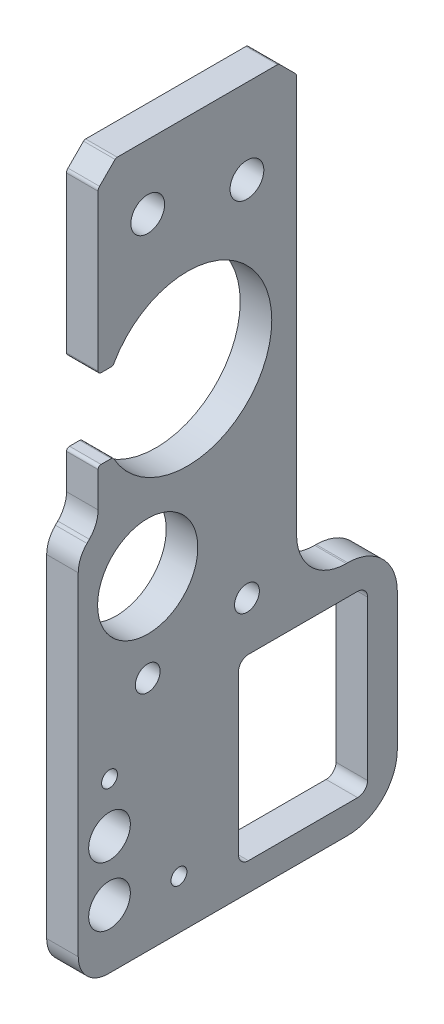
from build123d import *

# Parameters (mm, degrees)
SKETCH1_R             = 5.05
SKETCH1_R_2           = 1.7
SKETCH1_R_3           = 2.1
SKETCH1_R_4           = 0.8
SKETCH1_W             = 13
SKETCH1_H             = 18
BOSS_EXTRUDE1_DEPTH   = 3.18
CUT_EXTRUDE5_DEPTH    = 78.831812262
FILLET2_R             = 3
CHAMFER2_SIZE         = 1.8
FILLET4_R             = 0.5
FILLET5_R             = 0.3
M2X0_4_TAPPED_HOLE1_D = 1.6
FILLET9_R             = 1
FILLET11_R            = 5
M3X0_5_TAPPED_HOLE1_D = 2.5


with BuildPart() as part:
    # Sketch1 → Boss-Extrude1 (new body)
    with BuildSketch(Plane(origin=(0, 0, 0), x_dir=(0, 0, -1), z_dir=(1, 0, 0))):
        Polygon((0, 0), (0, 37.75), (2, 39.75), (2, 70.81), (22, 70.81), (22, 23.81), (32.15, 23.81), (32.15, 0), align=None)
        with Locations((7, 32.7)):
            Circle(SKETCH1_R, mode=Mode.SUBTRACT)
        with Locations((7, 64.31)):
            Circle(SKETCH1_R_2, mode=Mode.SUBTRACT)
        with Locations((17, 62.31)):
            Circle(SKETCH1_R_2, mode=Mode.SUBTRACT)
        with Locations((3.15, 5.95)):
            Circle(SKETCH1_R_3, mode=Mode.SUBTRACT)
        with Locations((3.15, 11.95)):
            Circle(SKETCH1_R_3, mode=Mode.SUBTRACT)
        with Locations((10.15, 4.95)):
            Circle(SKETCH1_R_4, mode=Mode.SUBTRACT)
        with Locations((3.15, 16.95)):
            Circle(SKETCH1_R_4, mode=Mode.SUBTRACT)
        with Locations((22.65, 11.81)):
            Rectangle(SKETCH1_W, SKETCH1_H, mode=Mode.SUBTRACT)
    extrude(amount=BOSS_EXTRUDE1_DEPTH)

    # Sketch8 → Cut-Extrude5 (cut, through all)
    with BuildSketch(Plane(origin=(3.18, 0, 0), x_dir=(0, 0, -1), z_dir=(1, 0, 0))):
        with BuildLine():
            Line((2, 52.810865899), (3.5, 52.810865899))
            ThreePointArc((3.5, 52.810865899), (19.5, 48.810865899), (3.5, 44.810865899))
            Line((3.5, 44.810865899), (2, 44.810865899))
            Line((2, 44.810865899), (2, 52.810865899))
        make_face()
    extrude(amount=-CUT_EXTRUDE5_DEPTH, mode=Mode.SUBTRACT)

    # Fillet2
    fillet2_edges = [part.edges().sort_by_distance(p)[0] for p in [
        (1.59, 37.75, 0),
        (1.59, 39.75, -2),
        (1.59, 0, 0),
    ]]
    fillet(fillet2_edges, radius=FILLET2_R)

    # Chamfer2
    chamfer2_edges = [part.edges().sort_by_distance(p)[0] for p in [
        (1.59, 70.81, -22),
        (1.59, 70.81, -2),
    ]]
    chamfer(chamfer2_edges, length=CHAMFER2_SIZE)

    # Fillet4
    fillet4_edges = [part.edges().sort_by_distance(p)[0] for p in [
        (1.59, 69.01, -2),
        (1.59, 69.01, -22),
    ]]
    fillet(fillet4_edges, radius=FILLET4_R)

    # Fillet5
    fillet5_edges = [part.edges().sort_by_distance(p)[0] for p in [
        (1.59, 70.81, -20.2),
        (1.59, 70.81, -3.8),
        (1.59, 52.810865899, -2),
        (1.59, 52.810865899, -3.5),
        (1.59, 44.810865899, -3.5),
        (1.59, 44.810865899, -2),
    ]]
    fillet(fillet5_edges, radius=FILLET5_R)

    # M2x0.4 Tapped Hole1 (through all)
    with Locations(Plane(origin=(0, 16.95, -3.15), x_dir=(0, 0, -1), z_dir=(-1, 0, 0))):
        with Locations((0, 0), (7, 12)):
            Hole(M2X0_4_TAPPED_HOLE1_D / 2)

    # Fillet9
    fillet9_edges = [part.edges().sort_by_distance(p)[0] for p in [
        (1.59, 2.81, -29.15),
        (1.59, 2.81, -16.15),
        (1.59, 20.81, -29.15),
        (1.59, 20.81, -16.15),
    ]]
    fillet(fillet9_edges, radius=FILLET9_R)

    # Fillet11
    fillet11_edges = [part.edges().sort_by_distance(p)[0] for p in [
        (1.59, 0, -32.15),
        (1.59, 23.81, -22),
        (1.59, 23.81, -32.15),
    ]]
    fillet(fillet11_edges, radius=FILLET11_R)

    # M3x0.5 Tapped Hole1 (through all)
    with Locations(Plane(origin=(3.18, 0, 0), x_dir=(0, 0, -1), z_dir=(1, 0, 0))):
        with Locations((7, 23.81), (17, 25.81)):
            Hole(M3X0_5_TAPPED_HOLE1_D / 2)


solid = part.part
